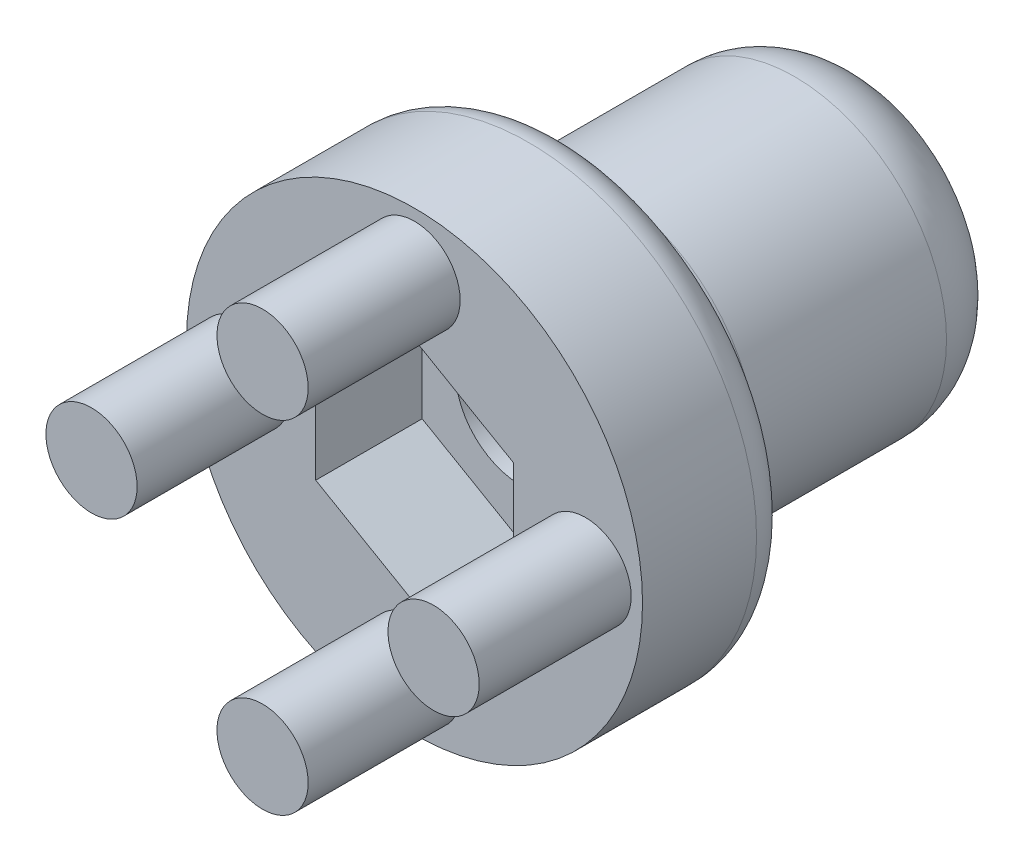
from build123d import *

# Parameters (mm, degrees)
SKETCH1_R           = 10
SKETCH1_R_2         = 4.3
BOSS_EXTRUDE2_DEPTH = 30
CUT_EXTRUDE1_DEPTH  = 7
BOSS_EXTRUDE3_START = -10
SKETCH3_R           = 15
SKETCH3_R_2         = 10
BOSS_EXTRUDE3_DEPTH = 10
FILLET1_R           = 2.5
FILLET2_R           = 5
SKETCH4_R           = 3
BOSS_EXTRUDE4_DEPTH = 10


with BuildPart() as part:
    # Sketch1 → Boss-Extrude2 (new body)
    with BuildSketch(Plane.XY):
        Circle(SKETCH1_R)
        Circle(SKETCH1_R_2, mode=Mode.SUBTRACT)
    extrude(amount=BOSS_EXTRUDE2_DEPTH)

    # Sketch2 → Cut-Extrude1 (cut)
    with BuildSketch(Plane.XY.offset(30)):
        Polygon((0, 7.505553499), (-6.5, 3.75277675), (-6.5, -3.75277675), (0, -7.505553499), (6.5, -3.75277675), (6.5, 3.75277675), align=None)
    extrude(amount=-CUT_EXTRUDE1_DEPTH, mode=Mode.SUBTRACT)

    # Sketch3 → Boss-Extrude3 (add)
    with BuildSketch(Plane.XY.offset(30).offset(BOSS_EXTRUDE3_START)):
        Circle(SKETCH3_R)
        Circle(SKETCH3_R_2, mode=Mode.SUBTRACT)
    extrude(amount=BOSS_EXTRUDE3_DEPTH)

    # Fillet1
    fillet1_edges = [part.edges().sort_by_distance(p)[0] for p in [
        (-10, 0, 20),
        (-15, 0, 20),
    ]]
    fillet(fillet1_edges, radius=FILLET1_R - 0.0001)  # a hair under: the kernel refuses the full size

    # Fillet2
    fillet2_edges = [part.edges().sort_by_distance(p)[0] for p in [
        (-10, 0, 0),
    ]]
    fillet(fillet2_edges, radius=FILLET2_R)

    # Sketch4 → Boss-Extrude4 (add)
    with BuildSketch(Plane.XY.offset(30)):
        with Locations((11.25277675, 0)):
            Circle(SKETCH4_R)
        with BuildLine():
            ThreePointArc((3, 11.25277675), (2.121320344, 13.374097093), (0, 14.25277675))
            Line((0, 14.25277675), (0, 8.25277675))
            ThreePointArc((0, 8.25277675), (2.121320344, 9.131456406), (3, 11.25277675))
        make_face()
        with BuildLine():
            Line((0, 8.25277675), (0, 14.25277675))
            ThreePointArc((0, 14.25277675), (-3, 11.25277675), (0, 8.25277675))
        make_face()
        with Locations((-11.25277675, 0)):
            Circle(SKETCH4_R)
        with Locations((0, -11.25277675)):
            Circle(SKETCH4_R)
    extrude(amount=BOSS_EXTRUDE4_DEPTH)


solid = part.part
